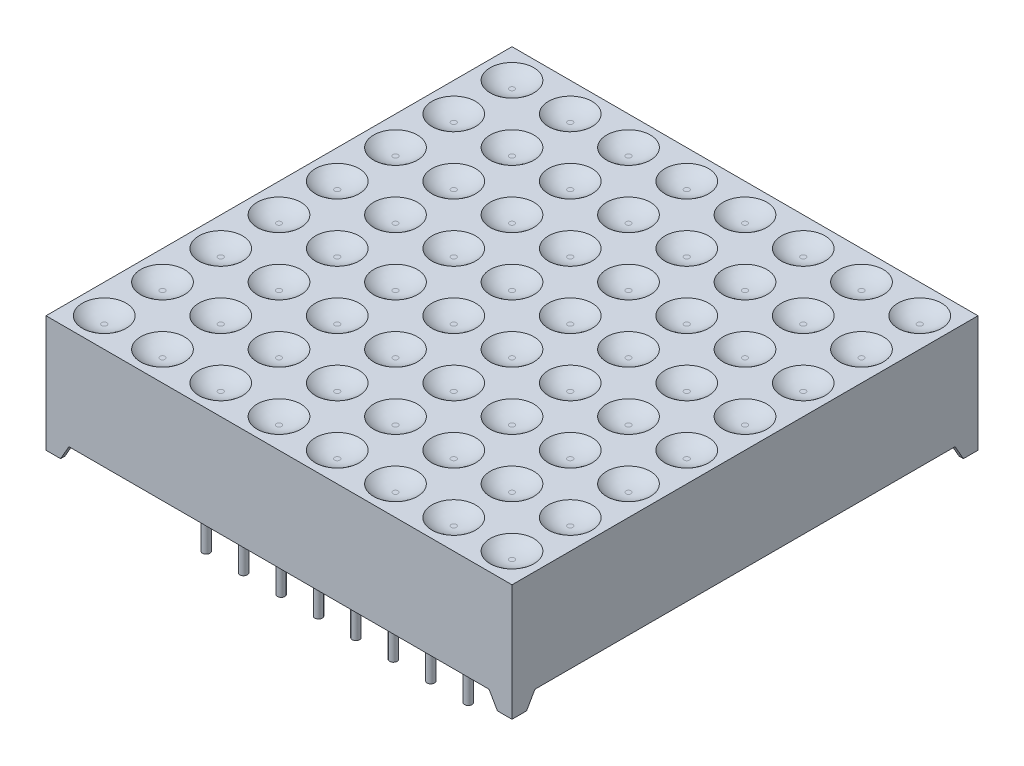
from build123d import *

# Parameters (mm, degrees)
SKETCH1_W           = 32
SKETCH1_H           = 32
BOSS_EXTRUDE1_DEPTH = 4
SKETCH2_W           = 31.4
SKETCH2_H           = 31.4
CUT_EXTRUDE1_DEPTH  = 1.5
CUT_EXTRUDE2_DEPTH  = 37
CUT_EXTRUDE3_DEPTH  = 37
SKETCH5_R           = 1.5
CUT_EXTRUDE4_DEPTH  = 0.5
FILLET1_R           = 2
SKETCH6_R           = 0.255
BOSS_EXTRUDE2_DEPTH = 6


with BuildPart() as part:
    # Sketch1 → Boss-Extrude1 (new, symmetric)
    with BuildSketch(Plane(origin=(0, 0, 0), x_dir=(1, 0, 0), z_dir=(0, 1, 0))):
        Rectangle(SKETCH1_W, SKETCH1_H)
    extrude(amount=BOSS_EXTRUDE1_DEPTH, both=True)

    # Sketch2 → Cut-Extrude1 (cut)
    with BuildSketch(Plane.XZ.offset(4)):
        Rectangle(SKETCH2_W, SKETCH2_H)
    extrude(amount=-CUT_EXTRUDE1_DEPTH, mode=Mode.SUBTRACT)

    # Sketch3 → Cut-Extrude2 (cut, through all)
    with BuildSketch(Plane.XY.offset(16)):
        Polygon((-15, -4), (-14.422649731, -3), (14.422649731, -3), (15, -4), align=None)
    extrude(amount=-CUT_EXTRUDE2_DEPTH, mode=Mode.SUBTRACT)

    # Sketch4 → Cut-Extrude3 (cut, through all)
    with BuildSketch(Plane.ZY.offset(16)):
        Polygon((-15, -4), (-14.422649731, -3), (14.422649731, -3), (15, -4), align=None)
    extrude(amount=-CUT_EXTRUDE3_DEPTH, mode=Mode.SUBTRACT)

    # Sketch5 → Cut-Extrude4 (cut)
    with BuildSketch(Plane(origin=(0, 4, 0), x_dir=(1, 0, 0), z_dir=(0, 1, 0))):
        with Locations(Location((-14, 14, 0), (0, 0, 270))):
            Circle(SKETCH5_R)
        with Locations(Location((-10, 14, 0), (0, 0, 270))):
            Circle(SKETCH5_R)
        with Locations(Location((-6, 14, 0), (0, 0, 270))):
            Circle(SKETCH5_R)
        with Locations(Location((-2, 14, 0), (0, 0, 270))):
            Circle(SKETCH5_R)
        with Locations(Location((2, 14, 0), (0, 0, 270))):
            Circle(SKETCH5_R)
        with Locations(Location((6, 14, 0), (0, 0, 270))):
            Circle(SKETCH5_R)
        with Locations(Location((10, 14, 0), (0, 0, 270))):
            Circle(SKETCH5_R)
        with Locations(Location((14, 14, 0), (0, 0, 270))):
            Circle(SKETCH5_R)
        with Locations(Location((-14, 10, 0), (0, 0, 270))):
            Circle(SKETCH5_R)
        with Locations(Location((-10, 10, 0), (0, 0, 270))):
            Circle(SKETCH5_R)
        with Locations(Location((-6, 10, 0), (0, 0, 270))):
            Circle(SKETCH5_R)
        with Locations(Location((-2, 10, 0), (0, 0, 270))):
            Circle(SKETCH5_R)
        with Locations(Location((2, 10, 0), (0, 0, 270))):
            Circle(SKETCH5_R)
        with Locations(Location((6, 10, 0), (0, 0, 270))):
            Circle(SKETCH5_R)
        with Locations(Location((10, 10, 0), (0, 0, 270))):
            Circle(SKETCH5_R)
        with Locations(Location((14, 10, 0), (0, 0, 270))):
            Circle(SKETCH5_R)
        with Locations(Location((-14, 6, 0), (0, 0, 270))):
            Circle(SKETCH5_R)
        with Locations(Location((-10, 6, 0), (0, 0, 270))):
            Circle(SKETCH5_R)
        with Locations(Location((-6, 6, 0), (0, 0, 270))):
            Circle(SKETCH5_R)
        with Locations(Location((-2, 6, 0), (0, 0, 270))):
            Circle(SKETCH5_R)
        with Locations(Location((2, 6, 0), (0, 0, 270))):
            Circle(SKETCH5_R)
        with Locations(Location((6, 6, 0), (0, 0, 270))):
            Circle(SKETCH5_R)
        with Locations(Location((10, 6, 0), (0, 0, 270))):
            Circle(SKETCH5_R)
        with Locations(Location((14, 6, 0), (0, 0, 270))):
            Circle(SKETCH5_R)
        with Locations(Location((-14, 2, 0), (0, 0, 270))):
            Circle(SKETCH5_R)
        with Locations(Location((-10, 2, 0), (0, 0, 270))):
            Circle(SKETCH5_R)
        with Locations(Location((-6, 2, 0), (0, 0, 270))):
            Circle(SKETCH5_R)
        with Locations(Location((-2, 2, 0), (0, 0, 270))):
            Circle(SKETCH5_R)
        with Locations(Location((2, 2, 0), (0, 0, 270))):
            Circle(SKETCH5_R)
        with Locations(Location((6, 2, 0), (0, 0, 270))):
            Circle(SKETCH5_R)
        with Locations(Location((10, 2, 0), (0, 0, 270))):
            Circle(SKETCH5_R)
        with Locations(Location((14, 2, 0), (0, 0, 270))):
            Circle(SKETCH5_R)
        with Locations(Location((-14, -2, 0), (0, 0, 270))):
            Circle(SKETCH5_R)
        with Locations(Location((-10, -2, 0), (0, 0, 270))):
            Circle(SKETCH5_R)
        with Locations(Location((-6, -2, 0), (0, 0, 270))):
            Circle(SKETCH5_R)
        with Locations(Location((-2, -2, 0), (0, 0, 270))):
            Circle(SKETCH5_R)
        with Locations(Location((2, -2, 0), (0, 0, 270))):
            Circle(SKETCH5_R)
        with Locations(Location((6, -2, 0), (0, 0, 270))):
            Circle(SKETCH5_R)
        with Locations(Location((10, -2, 0), (0, 0, 270))):
            Circle(SKETCH5_R)
        with Locations(Location((14, -2, 0), (0, 0, 270))):
            Circle(SKETCH5_R)
        with Locations(Location((-14, -6, 0), (0, 0, 270))):
            Circle(SKETCH5_R)
        with Locations(Location((-10, -6, 0), (0, 0, 270))):
            Circle(SKETCH5_R)
        with Locations(Location((-6, -6, 0), (0, 0, 270))):
            Circle(SKETCH5_R)
        with Locations(Location((-2, -6, 0), (0, 0, 270))):
            Circle(SKETCH5_R)
        with Locations(Location((2, -6, 0), (0, 0, 270))):
            Circle(SKETCH5_R)
        with Locations(Location((6, -6, 0), (0, 0, 270))):
            Circle(SKETCH5_R)
        with Locations(Location((10, -6, 0), (0, 0, 270))):
            Circle(SKETCH5_R)
        with Locations(Location((14, -6, 0), (0, 0, 270))):
            Circle(SKETCH5_R)
        with Locations(Location((-14, -10, 0), (0, 0, 270))):
            Circle(SKETCH5_R)
        with Locations(Location((-10, -10, 0), (0, 0, 270))):
            Circle(SKETCH5_R)
        with Locations(Location((-6, -10, 0), (0, 0, 270))):
            Circle(SKETCH5_R)
        with Locations(Location((-2, -10, 0), (0, 0, 270))):
            Circle(SKETCH5_R)
        with Locations(Location((2, -10, 0), (0, 0, 270))):
            Circle(SKETCH5_R)
        with Locations(Location((6, -10, 0), (0, 0, 270))):
            Circle(SKETCH5_R)
        with Locations(Location((10, -10, 0), (0, 0, 270))):
            Circle(SKETCH5_R)
        with Locations(Location((14, -10, 0), (0, 0, 270))):
            Circle(SKETCH5_R)
        with Locations(Location((-14, -14, 0), (0, 0, 270))):
            Circle(SKETCH5_R)
        with Locations(Location((-10, -14, 0), (0, 0, 270))):
            Circle(SKETCH5_R)
        with Locations(Location((-6, -14, 0), (0, 0, 270))):
            Circle(SKETCH5_R)
        with Locations(Location((-2, -14, 0), (0, 0, 270))):
            Circle(SKETCH5_R)
        with Locations(Location((2, -14, 0), (0, 0, 270))):
            Circle(SKETCH5_R)
        with Locations(Location((6, -14, 0), (0, 0, 270))):
            Circle(SKETCH5_R)
        with Locations(Location((10, -14, 0), (0, 0, 270))):
            Circle(SKETCH5_R)
        with Locations(Location((14, -14, 0), (0, 0, 270))):
            Circle(SKETCH5_R)
    extrude(amount=-CUT_EXTRUDE4_DEPTH, mode=Mode.SUBTRACT)

    # Fillet1
    # the kernel refuses this fillet: 2 mm, written as the material it adds along each edge
    with BuildSketch(Plane(origin=(6, 3.5, -14), x_dir=(0, 0, 1), z_dir=(-1, 0, 0))) as fillet1_piece_1:
        with BuildLine():
            CenterArc((0.177124344, 2), FILLET1_R, 270, 41.409622109)
            Line((0.177124344, 0), (0.177124344, -0.04))
            Line((0.177124344, -0.04), (1.5, -0.04))
            Line((1.5, -0.04), (1.54, 0))
            ThreePointArc((1.54, 0), (1.54, 0.25), (1.526457513, 0.47))
            Line((1.526457513, 0.47), (1.5, 0.5))
        make_face()
    fillet1_piece_1_solid = revolve(axis=Axis((6, 3.5, -14), (0, 1, 0)), mode=Mode.PRIVATE)
    with BuildSketch(Plane(origin=(10, 3.5, -14), x_dir=(0, 0, 1), z_dir=(-1, 0, 0))) as fillet1_piece_2:
        with BuildLine():
            CenterArc((0.177124344, 2), FILLET1_R, 270, 41.409622109)
            Line((0.177124344, 0), (0.177124344, -0.04))
            Line((0.177124344, -0.04), (1.5, -0.04))
            Line((1.5, -0.04), (1.54, 0))
            ThreePointArc((1.54, 0), (1.54, 0.25), (1.526457513, 0.47))
            Line((1.526457513, 0.47), (1.5, 0.5))
        make_face()
    fillet1_piece_2_solid = revolve(axis=Axis((10, 3.5, -14), (0, 1, 0)), mode=Mode.PRIVATE)
    with BuildSketch(Plane(origin=(14, 3.5, -14), x_dir=(0, 0, 1), z_dir=(-1, 0, 0))) as fillet1_piece_3:
        with BuildLine():
            CenterArc((0.177124344, 2), FILLET1_R, 270, 41.409622109)
            Line((0.177124344, 0), (0.177124344, -0.04))
            Line((0.177124344, -0.04), (1.5, -0.04))
            Line((1.5, -0.04), (1.54, 0))
            ThreePointArc((1.54, 0), (1.54, 0.25), (1.526457513, 0.47))
            Line((1.526457513, 0.47), (1.5, 0.5))
        make_face()
    fillet1_piece_3_solid = revolve(axis=Axis((14, 3.5, -14), (0, 1, 0)), mode=Mode.PRIVATE)
    with BuildSketch(Plane(origin=(-14, 3.5, -10), x_dir=(0, 0, 1), z_dir=(-1, 0, 0))) as fillet1_piece_4:
        with BuildLine():
            CenterArc((0.177124344, 2), FILLET1_R, 270, 41.409622109)
            Line((0.177124344, 0), (0.177124344, -0.04))
            Line((0.177124344, -0.04), (1.5, -0.04))
            Line((1.5, -0.04), (1.54, 0))
            ThreePointArc((1.54, 0), (1.54, 0.25), (1.526457513, 0.47))
            Line((1.526457513, 0.47), (1.5, 0.5))
        make_face()
    fillet1_piece_4_solid = revolve(axis=Axis((-14, 3.5, -10), (0, 1, 0)), mode=Mode.PRIVATE)
    with BuildSketch(Plane(origin=(-10, 3.5, -10), x_dir=(0, 0, 1), z_dir=(-1, 0, 0))) as fillet1_piece_5:
        with BuildLine():
            CenterArc((0.177124344, 2), FILLET1_R, 270, 41.409622109)
            Line((0.177124344, 0), (0.177124344, -0.04))
            Line((0.177124344, -0.04), (1.5, -0.04))
            Line((1.5, -0.04), (1.54, 0))
            ThreePointArc((1.54, 0), (1.54, 0.25), (1.526457513, 0.47))
            Line((1.526457513, 0.47), (1.5, 0.5))
        make_face()
    fillet1_piece_5_solid = revolve(axis=Axis((-10, 3.5, -10), (0, 1, 0)), mode=Mode.PRIVATE)
    with BuildSketch(Plane(origin=(-6, 3.5, -10), x_dir=(0, 0, 1), z_dir=(-1, 0, 0))) as fillet1_piece_6:
        with BuildLine():
            CenterArc((0.177124344, 2), FILLET1_R, 270, 41.409622109)
            Line((0.177124344, 0), (0.177124344, -0.04))
            Line((0.177124344, -0.04), (1.5, -0.04))
            Line((1.5, -0.04), (1.54, 0))
            ThreePointArc((1.54, 0), (1.54, 0.25), (1.526457513, 0.47))
            Line((1.526457513, 0.47), (1.5, 0.5))
        make_face()
    fillet1_piece_6_solid = revolve(axis=Axis((-6, 3.5, -10), (0, 1, 0)), mode=Mode.PRIVATE)
    with BuildSketch(Plane(origin=(-2, 3.5, -10), x_dir=(0, 0, 1), z_dir=(-1, 0, 0))) as fillet1_piece_7:
        with BuildLine():
            CenterArc((0.177124344, 2), FILLET1_R, 270, 41.409622109)
            Line((0.177124344, 0), (0.177124344, -0.04))
            Line((0.177124344, -0.04), (1.5, -0.04))
            Line((1.5, -0.04), (1.54, 0))
            ThreePointArc((1.54, 0), (1.54, 0.25), (1.526457513, 0.47))
            Line((1.526457513, 0.47), (1.5, 0.5))
        make_face()
    fillet1_piece_7_solid = revolve(axis=Axis((-2, 3.5, -10), (0, 1, 0)), mode=Mode.PRIVATE)
    with BuildSketch(Plane(origin=(2, 3.5, -10), x_dir=(0, 0, 1), z_dir=(-1, 0, 0))) as fillet1_piece_8:
        with BuildLine():
            CenterArc((0.177124344, 2), FILLET1_R, 270, 41.409622109)
            Line((0.177124344, 0), (0.177124344, -0.04))
            Line((0.177124344, -0.04), (1.5, -0.04))
            Line((1.5, -0.04), (1.54, 0))
            ThreePointArc((1.54, 0), (1.54, 0.25), (1.526457513, 0.47))
            Line((1.526457513, 0.47), (1.5, 0.5))
        make_face()
    fillet1_piece_8_solid = revolve(axis=Axis((2, 3.5, -10), (0, 1, 0)), mode=Mode.PRIVATE)
    with BuildSketch(Plane(origin=(6, 3.5, -10), x_dir=(0, 0, 1), z_dir=(-1, 0, 0))) as fillet1_piece_9:
        with BuildLine():
            CenterArc((0.177124344, 2), FILLET1_R, 270, 41.409622109)
            Line((0.177124344, 0), (0.177124344, -0.04))
            Line((0.177124344, -0.04), (1.5, -0.04))
            Line((1.5, -0.04), (1.54, 0))
            ThreePointArc((1.54, 0), (1.54, 0.25), (1.526457513, 0.47))
            Line((1.526457513, 0.47), (1.5, 0.5))
        make_face()
    fillet1_piece_9_solid = revolve(axis=Axis((6, 3.5, -10), (0, 1, 0)), mode=Mode.PRIVATE)
    with BuildSketch(Plane(origin=(10, 3.5, -10), x_dir=(0, 0, 1), z_dir=(-1, 0, 0))) as fillet1_piece_10:
        with BuildLine():
            CenterArc((0.177124344, 2), FILLET1_R, 270, 41.409622109)
            Line((0.177124344, 0), (0.177124344, -0.04))
            Line((0.177124344, -0.04), (1.5, -0.04))
            Line((1.5, -0.04), (1.54, 0))
            ThreePointArc((1.54, 0), (1.54, 0.25), (1.526457513, 0.47))
            Line((1.526457513, 0.47), (1.5, 0.5))
        make_face()
    fillet1_piece_10_solid = revolve(axis=Axis((10, 3.5, -10), (0, 1, 0)), mode=Mode.PRIVATE)
    with BuildSketch(Plane(origin=(14, 3.5, -10), x_dir=(0, 0, 1), z_dir=(-1, 0, 0))) as fillet1_piece_11:
        with BuildLine():
            CenterArc((0.177124344, 2), FILLET1_R, 270, 41.409622109)
            Line((0.177124344, 0), (0.177124344, -0.04))
            Line((0.177124344, -0.04), (1.5, -0.04))
            Line((1.5, -0.04), (1.54, 0))
            ThreePointArc((1.54, 0), (1.54, 0.25), (1.526457513, 0.47))
            Line((1.526457513, 0.47), (1.5, 0.5))
        make_face()
    fillet1_piece_11_solid = revolve(axis=Axis((14, 3.5, -10), (0, 1, 0)), mode=Mode.PRIVATE)
    with BuildSketch(Plane(origin=(-14, 3.5, -6), x_dir=(0, 0, 1), z_dir=(-1, 0, 0))) as fillet1_piece_12:
        with BuildLine():
            CenterArc((0.177124344, 2), FILLET1_R, 270, 41.409622109)
            Line((0.177124344, 0), (0.177124344, -0.04))
            Line((0.177124344, -0.04), (1.5, -0.04))
            Line((1.5, -0.04), (1.54, 0))
            ThreePointArc((1.54, 0), (1.54, 0.25), (1.526457513, 0.47))
            Line((1.526457513, 0.47), (1.5, 0.5))
        make_face()
    fillet1_piece_12_solid = revolve(axis=Axis((-14, 3.5, -6), (0, 1, 0)), mode=Mode.PRIVATE)
    with BuildSketch(Plane(origin=(-10, 3.5, -6), x_dir=(0, 0, 1), z_dir=(-1, 0, 0))) as fillet1_piece_13:
        with BuildLine():
            CenterArc((0.177124344, 2), FILLET1_R, 270, 41.409622109)
            Line((0.177124344, 0), (0.177124344, -0.04))
            Line((0.177124344, -0.04), (1.5, -0.04))
            Line((1.5, -0.04), (1.54, 0))
            ThreePointArc((1.54, 0), (1.54, 0.25), (1.526457513, 0.47))
            Line((1.526457513, 0.47), (1.5, 0.5))
        make_face()
    fillet1_piece_13_solid = revolve(axis=Axis((-10, 3.5, -6), (0, 1, 0)), mode=Mode.PRIVATE)
    with BuildSketch(Plane(origin=(-6, 3.5, -6), x_dir=(0, 0, 1), z_dir=(-1, 0, 0))) as fillet1_piece_14:
        with BuildLine():
            CenterArc((0.177124344, 2), FILLET1_R, 270, 41.409622109)
            Line((0.177124344, 0), (0.177124344, -0.04))
            Line((0.177124344, -0.04), (1.5, -0.04))
            Line((1.5, -0.04), (1.54, 0))
            ThreePointArc((1.54, 0), (1.54, 0.25), (1.526457513, 0.47))
            Line((1.526457513, 0.47), (1.5, 0.5))
        make_face()
    fillet1_piece_14_solid = revolve(axis=Axis((-6, 3.5, -6), (0, 1, 0)), mode=Mode.PRIVATE)
    with BuildSketch(Plane(origin=(-2, 3.5, -6), x_dir=(0, 0, 1), z_dir=(-1, 0, 0))) as fillet1_piece_15:
        with BuildLine():
            CenterArc((0.177124344, 2), FILLET1_R, 270, 41.409622109)
            Line((0.177124344, 0), (0.177124344, -0.04))
            Line((0.177124344, -0.04), (1.5, -0.04))
            Line((1.5, -0.04), (1.54, 0))
            ThreePointArc((1.54, 0), (1.54, 0.25), (1.526457513, 0.47))
            Line((1.526457513, 0.47), (1.5, 0.5))
        make_face()
    fillet1_piece_15_solid = revolve(axis=Axis((-2, 3.5, -6), (0, 1, 0)), mode=Mode.PRIVATE)
    with BuildSketch(Plane(origin=(2, 3.5, -6), x_dir=(0, 0, 1), z_dir=(-1, 0, 0))) as fillet1_piece_16:
        with BuildLine():
            CenterArc((0.177124344, 2), FILLET1_R, 270, 41.409622109)
            Line((0.177124344, 0), (0.177124344, -0.04))
            Line((0.177124344, -0.04), (1.5, -0.04))
            Line((1.5, -0.04), (1.54, 0))
            ThreePointArc((1.54, 0), (1.54, 0.25), (1.526457513, 0.47))
            Line((1.526457513, 0.47), (1.5, 0.5))
        make_face()
    fillet1_piece_16_solid = revolve(axis=Axis((2, 3.5, -6), (0, 1, 0)), mode=Mode.PRIVATE)
    with BuildSketch(Plane(origin=(6, 3.5, -6), x_dir=(0, 0, 1), z_dir=(-1, 0, 0))) as fillet1_piece_17:
        with BuildLine():
            CenterArc((0.177124344, 2), FILLET1_R, 270, 41.409622109)
            Line((0.177124344, 0), (0.177124344, -0.04))
            Line((0.177124344, -0.04), (1.5, -0.04))
            Line((1.5, -0.04), (1.54, 0))
            ThreePointArc((1.54, 0), (1.54, 0.25), (1.526457513, 0.47))
            Line((1.526457513, 0.47), (1.5, 0.5))
        make_face()
    fillet1_piece_17_solid = revolve(axis=Axis((6, 3.5, -6), (0, 1, 0)), mode=Mode.PRIVATE)
    with BuildSketch(Plane(origin=(10, 3.5, -6), x_dir=(0, 0, 1), z_dir=(-1, 0, 0))) as fillet1_piece_18:
        with BuildLine():
            CenterArc((0.177124344, 2), FILLET1_R, 270, 41.409622109)
            Line((0.177124344, 0), (0.177124344, -0.04))
            Line((0.177124344, -0.04), (1.5, -0.04))
            Line((1.5, -0.04), (1.54, 0))
            ThreePointArc((1.54, 0), (1.54, 0.25), (1.526457513, 0.47))
            Line((1.526457513, 0.47), (1.5, 0.5))
        make_face()
    fillet1_piece_18_solid = revolve(axis=Axis((10, 3.5, -6), (0, 1, 0)), mode=Mode.PRIVATE)
    with BuildSketch(Plane(origin=(14, 3.5, -6), x_dir=(0, 0, 1), z_dir=(-1, 0, 0))) as fillet1_piece_19:
        with BuildLine():
            CenterArc((0.177124344, 2), FILLET1_R, 270, 41.409622109)
            Line((0.177124344, 0), (0.177124344, -0.04))
            Line((0.177124344, -0.04), (1.5, -0.04))
            Line((1.5, -0.04), (1.54, 0))
            ThreePointArc((1.54, 0), (1.54, 0.25), (1.526457513, 0.47))
            Line((1.526457513, 0.47), (1.5, 0.5))
        make_face()
    fillet1_piece_19_solid = revolve(axis=Axis((14, 3.5, -6), (0, 1, 0)), mode=Mode.PRIVATE)
    with BuildSketch(Plane(origin=(-14, 3.5, -2), x_dir=(0, 0, 1), z_dir=(-1, 0, 0))) as fillet1_piece_20:
        with BuildLine():
            CenterArc((0.177124344, 2), FILLET1_R, 270, 41.409622109)
            Line((0.177124344, 0), (0.177124344, -0.04))
            Line((0.177124344, -0.04), (1.5, -0.04))
            Line((1.5, -0.04), (1.54, 0))
            ThreePointArc((1.54, 0), (1.54, 0.25), (1.526457513, 0.47))
            Line((1.526457513, 0.47), (1.5, 0.5))
        make_face()
    fillet1_piece_20_solid = revolve(axis=Axis((-14, 3.5, -2), (0, 1, 0)), mode=Mode.PRIVATE)
    with BuildSketch(Plane(origin=(-10, 3.5, -2), x_dir=(0, 0, 1), z_dir=(-1, 0, 0))) as fillet1_piece_21:
        with BuildLine():
            CenterArc((0.177124344, 2), FILLET1_R, 270, 41.409622109)
            Line((0.177124344, 0), (0.177124344, -0.04))
            Line((0.177124344, -0.04), (1.5, -0.04))
            Line((1.5, -0.04), (1.54, 0))
            ThreePointArc((1.54, 0), (1.54, 0.25), (1.526457513, 0.47))
            Line((1.526457513, 0.47), (1.5, 0.5))
        make_face()
    fillet1_piece_21_solid = revolve(axis=Axis((-10, 3.5, -2), (0, 1, 0)), mode=Mode.PRIVATE)
    with BuildSketch(Plane(origin=(-6, 3.5, -2), x_dir=(0, 0, 1), z_dir=(-1, 0, 0))) as fillet1_piece_22:
        with BuildLine():
            CenterArc((0.177124344, 2), FILLET1_R, 270, 41.409622109)
            Line((0.177124344, 0), (0.177124344, -0.04))
            Line((0.177124344, -0.04), (1.5, -0.04))
            Line((1.5, -0.04), (1.54, 0))
            ThreePointArc((1.54, 0), (1.54, 0.25), (1.526457513, 0.47))
            Line((1.526457513, 0.47), (1.5, 0.5))
        make_face()
    fillet1_piece_22_solid = revolve(axis=Axis((-6, 3.5, -2), (0, 1, 0)), mode=Mode.PRIVATE)
    with BuildSketch(Plane(origin=(-2, 3.5, -2), x_dir=(0, 0, 1), z_dir=(-1, 0, 0))) as fillet1_piece_23:
        with BuildLine():
            CenterArc((0.177124344, 2), FILLET1_R, 270, 41.409622109)
            Line((0.177124344, 0), (0.177124344, -0.04))
            Line((0.177124344, -0.04), (1.5, -0.04))
            Line((1.5, -0.04), (1.54, 0))
            ThreePointArc((1.54, 0), (1.54, 0.25), (1.526457513, 0.47))
            Line((1.526457513, 0.47), (1.5, 0.5))
        make_face()
    fillet1_piece_23_solid = revolve(axis=Axis((-2, 3.5, -2), (0, 1, 0)), mode=Mode.PRIVATE)
    with BuildSketch(Plane(origin=(2, 3.5, -2), x_dir=(0, 0, 1), z_dir=(-1, 0, 0))) as fillet1_piece_24:
        with BuildLine():
            CenterArc((0.177124344, 2), FILLET1_R, 270, 41.409622109)
            Line((0.177124344, 0), (0.177124344, -0.04))
            Line((0.177124344, -0.04), (1.5, -0.04))
            Line((1.5, -0.04), (1.54, 0))
            ThreePointArc((1.54, 0), (1.54, 0.25), (1.526457513, 0.47))
            Line((1.526457513, 0.47), (1.5, 0.5))
        make_face()
    fillet1_piece_24_solid = revolve(axis=Axis((2, 3.5, -2), (0, 1, 0)), mode=Mode.PRIVATE)
    with BuildSketch(Plane(origin=(6, 3.5, -2), x_dir=(0, 0, 1), z_dir=(-1, 0, 0))) as fillet1_piece_25:
        with BuildLine():
            CenterArc((0.177124344, 2), FILLET1_R, 270, 41.409622109)
            Line((0.177124344, 0), (0.177124344, -0.04))
            Line((0.177124344, -0.04), (1.5, -0.04))
            Line((1.5, -0.04), (1.54, 0))
            ThreePointArc((1.54, 0), (1.54, 0.25), (1.526457513, 0.47))
            Line((1.526457513, 0.47), (1.5, 0.5))
        make_face()
    fillet1_piece_25_solid = revolve(axis=Axis((6, 3.5, -2), (0, 1, 0)), mode=Mode.PRIVATE)
    with BuildSketch(Plane(origin=(10, 3.5, -2), x_dir=(0, 0, 1), z_dir=(-1, 0, 0))) as fillet1_piece_26:
        with BuildLine():
            CenterArc((0.177124344, 2), FILLET1_R, 270, 41.409622109)
            Line((0.177124344, 0), (0.177124344, -0.04))
            Line((0.177124344, -0.04), (1.5, -0.04))
            Line((1.5, -0.04), (1.54, 0))
            ThreePointArc((1.54, 0), (1.54, 0.25), (1.526457513, 0.47))
            Line((1.526457513, 0.47), (1.5, 0.5))
        make_face()
    fillet1_piece_26_solid = revolve(axis=Axis((10, 3.5, -2), (0, 1, 0)), mode=Mode.PRIVATE)
    with BuildSketch(Plane(origin=(14, 3.5, -2), x_dir=(0, 0, 1), z_dir=(-1, 0, 0))) as fillet1_piece_27:
        with BuildLine():
            CenterArc((0.177124344, 2), FILLET1_R, 270, 41.409622109)
            Line((0.177124344, 0), (0.177124344, -0.04))
            Line((0.177124344, -0.04), (1.5, -0.04))
            Line((1.5, -0.04), (1.54, 0))
            ThreePointArc((1.54, 0), (1.54, 0.25), (1.526457513, 0.47))
            Line((1.526457513, 0.47), (1.5, 0.5))
        make_face()
    fillet1_piece_27_solid = revolve(axis=Axis((14, 3.5, -2), (0, 1, 0)), mode=Mode.PRIVATE)
    with BuildSketch(Plane(origin=(-14, 3.5, 2), x_dir=(0, 0, 1), z_dir=(-1, 0, 0))) as fillet1_piece_28:
        with BuildLine():
            CenterArc((0.177124344, 2), FILLET1_R, 270, 41.409622109)
            Line((0.177124344, 0), (0.177124344, -0.04))
            Line((0.177124344, -0.04), (1.5, -0.04))
            Line((1.5, -0.04), (1.54, 0))
            ThreePointArc((1.54, 0), (1.54, 0.25), (1.526457513, 0.47))
            Line((1.526457513, 0.47), (1.5, 0.5))
        make_face()
    fillet1_piece_28_solid = revolve(axis=Axis((-14, 3.5, 2), (0, 1, 0)), mode=Mode.PRIVATE)
    with BuildSketch(Plane(origin=(-10, 3.5, 2), x_dir=(0, 0, 1), z_dir=(-1, 0, 0))) as fillet1_piece_29:
        with BuildLine():
            CenterArc((0.177124344, 2), FILLET1_R, 270, 41.409622109)
            Line((0.177124344, 0), (0.177124344, -0.04))
            Line((0.177124344, -0.04), (1.5, -0.04))
            Line((1.5, -0.04), (1.54, 0))
            ThreePointArc((1.54, 0), (1.54, 0.25), (1.526457513, 0.47))
            Line((1.526457513, 0.47), (1.5, 0.5))
        make_face()
    fillet1_piece_29_solid = revolve(axis=Axis((-10, 3.5, 2), (0, 1, 0)), mode=Mode.PRIVATE)
    with BuildSketch(Plane(origin=(-6, 3.5, 2), x_dir=(0, 0, 1), z_dir=(-1, 0, 0))) as fillet1_piece_30:
        with BuildLine():
            CenterArc((0.177124344, 2), FILLET1_R, 270, 41.409622109)
            Line((0.177124344, 0), (0.177124344, -0.04))
            Line((0.177124344, -0.04), (1.5, -0.04))
            Line((1.5, -0.04), (1.54, 0))
            ThreePointArc((1.54, 0), (1.54, 0.25), (1.526457513, 0.47))
            Line((1.526457513, 0.47), (1.5, 0.5))
        make_face()
    fillet1_piece_30_solid = revolve(axis=Axis((-6, 3.5, 2), (0, 1, 0)), mode=Mode.PRIVATE)
    with BuildSketch(Plane(origin=(-2, 3.5, 2), x_dir=(0, 0, 1), z_dir=(-1, 0, 0))) as fillet1_piece_31:
        with BuildLine():
            CenterArc((0.177124344, 2), FILLET1_R, 270, 41.409622109)
            Line((0.177124344, 0), (0.177124344, -0.04))
            Line((0.177124344, -0.04), (1.5, -0.04))
            Line((1.5, -0.04), (1.54, 0))
            ThreePointArc((1.54, 0), (1.54, 0.25), (1.526457513, 0.47))
            Line((1.526457513, 0.47), (1.5, 0.5))
        make_face()
    fillet1_piece_31_solid = revolve(axis=Axis((-2, 3.5, 2), (0, 1, 0)), mode=Mode.PRIVATE)
    with BuildSketch(Plane(origin=(2, 3.5, 2), x_dir=(0, 0, 1), z_dir=(-1, 0, 0))) as fillet1_piece_32:
        with BuildLine():
            CenterArc((0.177124344, 2), FILLET1_R, 270, 41.409622109)
            Line((0.177124344, 0), (0.177124344, -0.04))
            Line((0.177124344, -0.04), (1.5, -0.04))
            Line((1.5, -0.04), (1.54, 0))
            ThreePointArc((1.54, 0), (1.54, 0.25), (1.526457513, 0.47))
            Line((1.526457513, 0.47), (1.5, 0.5))
        make_face()
    fillet1_piece_32_solid = revolve(axis=Axis((2, 3.5, 2), (0, 1, 0)), mode=Mode.PRIVATE)
    with BuildSketch(Plane(origin=(6, 3.5, 2), x_dir=(0, 0, 1), z_dir=(-1, 0, 0))) as fillet1_piece_33:
        with BuildLine():
            CenterArc((0.177124344, 2), FILLET1_R, 270, 41.409622109)
            Line((0.177124344, 0), (0.177124344, -0.04))
            Line((0.177124344, -0.04), (1.5, -0.04))
            Line((1.5, -0.04), (1.54, 0))
            ThreePointArc((1.54, 0), (1.54, 0.25), (1.526457513, 0.47))
            Line((1.526457513, 0.47), (1.5, 0.5))
        make_face()
    fillet1_piece_33_solid = revolve(axis=Axis((6, 3.5, 2), (0, 1, 0)), mode=Mode.PRIVATE)
    with BuildSketch(Plane(origin=(10, 3.5, 2), x_dir=(0, 0, 1), z_dir=(-1, 0, 0))) as fillet1_piece_34:
        with BuildLine():
            CenterArc((0.177124344, 2), FILLET1_R, 270, 41.409622109)
            Line((0.177124344, 0), (0.177124344, -0.04))
            Line((0.177124344, -0.04), (1.5, -0.04))
            Line((1.5, -0.04), (1.54, 0))
            ThreePointArc((1.54, 0), (1.54, 0.25), (1.526457513, 0.47))
            Line((1.526457513, 0.47), (1.5, 0.5))
        make_face()
    fillet1_piece_34_solid = revolve(axis=Axis((10, 3.5, 2), (0, 1, 0)), mode=Mode.PRIVATE)
    with BuildSketch(Plane(origin=(14, 3.5, 2), x_dir=(0, 0, 1), z_dir=(-1, 0, 0))) as fillet1_piece_35:
        with BuildLine():
            CenterArc((0.177124344, 2), FILLET1_R, 270, 41.409622109)
            Line((0.177124344, 0), (0.177124344, -0.04))
            Line((0.177124344, -0.04), (1.5, -0.04))
            Line((1.5, -0.04), (1.54, 0))
            ThreePointArc((1.54, 0), (1.54, 0.25), (1.526457513, 0.47))
            Line((1.526457513, 0.47), (1.5, 0.5))
        make_face()
    fillet1_piece_35_solid = revolve(axis=Axis((14, 3.5, 2), (0, 1, 0)), mode=Mode.PRIVATE)
    with BuildSketch(Plane(origin=(-14, 3.5, 6), x_dir=(0, 0, 1), z_dir=(-1, 0, 0))) as fillet1_piece_36:
        with BuildLine():
            CenterArc((0.177124344, 2), FILLET1_R, 270, 41.409622109)
            Line((0.177124344, 0), (0.177124344, -0.04))
            Line((0.177124344, -0.04), (1.5, -0.04))
            Line((1.5, -0.04), (1.54, 0))
            ThreePointArc((1.54, 0), (1.54, 0.25), (1.526457513, 0.47))
            Line((1.526457513, 0.47), (1.5, 0.5))
        make_face()
    fillet1_piece_36_solid = revolve(axis=Axis((-14, 3.5, 6), (0, 1, 0)), mode=Mode.PRIVATE)
    with BuildSketch(Plane(origin=(-10, 3.5, 6), x_dir=(0, 0, 1), z_dir=(-1, 0, 0))) as fillet1_piece_37:
        with BuildLine():
            CenterArc((0.177124344, 2), FILLET1_R, 270, 41.409622109)
            Line((0.177124344, 0), (0.177124344, -0.04))
            Line((0.177124344, -0.04), (1.5, -0.04))
            Line((1.5, -0.04), (1.54, 0))
            ThreePointArc((1.54, 0), (1.54, 0.25), (1.526457513, 0.47))
            Line((1.526457513, 0.47), (1.5, 0.5))
        make_face()
    fillet1_piece_37_solid = revolve(axis=Axis((-10, 3.5, 6), (0, 1, 0)), mode=Mode.PRIVATE)
    with BuildSketch(Plane(origin=(-6, 3.5, 6), x_dir=(0, 0, 1), z_dir=(-1, 0, 0))) as fillet1_piece_38:
        with BuildLine():
            CenterArc((0.177124344, 2), FILLET1_R, 270, 41.409622109)
            Line((0.177124344, 0), (0.177124344, -0.04))
            Line((0.177124344, -0.04), (1.5, -0.04))
            Line((1.5, -0.04), (1.54, 0))
            ThreePointArc((1.54, 0), (1.54, 0.25), (1.526457513, 0.47))
            Line((1.526457513, 0.47), (1.5, 0.5))
        make_face()
    fillet1_piece_38_solid = revolve(axis=Axis((-6, 3.5, 6), (0, 1, 0)), mode=Mode.PRIVATE)
    with BuildSketch(Plane(origin=(-2, 3.5, 6), x_dir=(0, 0, 1), z_dir=(-1, 0, 0))) as fillet1_piece_39:
        with BuildLine():
            CenterArc((0.177124344, 2), FILLET1_R, 270, 41.409622109)
            Line((0.177124344, 0), (0.177124344, -0.04))
            Line((0.177124344, -0.04), (1.5, -0.04))
            Line((1.5, -0.04), (1.54, 0))
            ThreePointArc((1.54, 0), (1.54, 0.25), (1.526457513, 0.47))
            Line((1.526457513, 0.47), (1.5, 0.5))
        make_face()
    fillet1_piece_39_solid = revolve(axis=Axis((-2, 3.5, 6), (0, 1, 0)), mode=Mode.PRIVATE)
    with BuildSketch(Plane(origin=(2, 3.5, 6), x_dir=(0, 0, 1), z_dir=(-1, 0, 0))) as fillet1_piece_40:
        with BuildLine():
            CenterArc((0.177124344, 2), FILLET1_R, 270, 41.409622109)
            Line((0.177124344, 0), (0.177124344, -0.04))
            Line((0.177124344, -0.04), (1.5, -0.04))
            Line((1.5, -0.04), (1.54, 0))
            ThreePointArc((1.54, 0), (1.54, 0.25), (1.526457513, 0.47))
            Line((1.526457513, 0.47), (1.5, 0.5))
        make_face()
    fillet1_piece_40_solid = revolve(axis=Axis((2, 3.5, 6), (0, 1, 0)), mode=Mode.PRIVATE)
    with BuildSketch(Plane(origin=(6, 3.5, 6), x_dir=(0, 0, 1), z_dir=(-1, 0, 0))) as fillet1_piece_41:
        with BuildLine():
            CenterArc((0.177124344, 2), FILLET1_R, 270, 41.409622109)
            Line((0.177124344, 0), (0.177124344, -0.04))
            Line((0.177124344, -0.04), (1.5, -0.04))
            Line((1.5, -0.04), (1.54, 0))
            ThreePointArc((1.54, 0), (1.54, 0.25), (1.526457513, 0.47))
            Line((1.526457513, 0.47), (1.5, 0.5))
        make_face()
    fillet1_piece_41_solid = revolve(axis=Axis((6, 3.5, 6), (0, 1, 0)), mode=Mode.PRIVATE)
    with BuildSketch(Plane(origin=(10, 3.5, 6), x_dir=(0, 0, 1), z_dir=(-1, 0, 0))) as fillet1_piece_42:
        with BuildLine():
            CenterArc((0.177124344, 2), FILLET1_R, 270, 41.409622109)
            Line((0.177124344, 0), (0.177124344, -0.04))
            Line((0.177124344, -0.04), (1.5, -0.04))
            Line((1.5, -0.04), (1.54, 0))
            ThreePointArc((1.54, 0), (1.54, 0.25), (1.526457513, 0.47))
            Line((1.526457513, 0.47), (1.5, 0.5))
        make_face()
    fillet1_piece_42_solid = revolve(axis=Axis((10, 3.5, 6), (0, 1, 0)), mode=Mode.PRIVATE)
    with BuildSketch(Plane(origin=(14, 3.5, 6), x_dir=(0, 0, 1), z_dir=(-1, 0, 0))) as fillet1_piece_43:
        with BuildLine():
            CenterArc((0.177124344, 2), FILLET1_R, 270, 41.409622109)
            Line((0.177124344, 0), (0.177124344, -0.04))
            Line((0.177124344, -0.04), (1.5, -0.04))
            Line((1.5, -0.04), (1.54, 0))
            ThreePointArc((1.54, 0), (1.54, 0.25), (1.526457513, 0.47))
            Line((1.526457513, 0.47), (1.5, 0.5))
        make_face()
    fillet1_piece_43_solid = revolve(axis=Axis((14, 3.5, 6), (0, 1, 0)), mode=Mode.PRIVATE)
    with BuildSketch(Plane(origin=(-14, 3.5, 10), x_dir=(0, 0, 1), z_dir=(-1, 0, 0))) as fillet1_piece_44:
        with BuildLine():
            CenterArc((0.177124344, 2), FILLET1_R, 270, 41.409622109)
            Line((0.177124344, 0), (0.177124344, -0.04))
            Line((0.177124344, -0.04), (1.5, -0.04))
            Line((1.5, -0.04), (1.54, 0))
            ThreePointArc((1.54, 0), (1.54, 0.25), (1.526457513, 0.47))
            Line((1.526457513, 0.47), (1.5, 0.5))
        make_face()
    fillet1_piece_44_solid = revolve(axis=Axis((-14, 3.5, 10), (0, 1, 0)), mode=Mode.PRIVATE)
    with BuildSketch(Plane(origin=(-10, 3.5, 10), x_dir=(0, 0, 1), z_dir=(-1, 0, 0))) as fillet1_piece_45:
        with BuildLine():
            CenterArc((0.177124344, 2), FILLET1_R, 270, 41.409622109)
            Line((0.177124344, 0), (0.177124344, -0.04))
            Line((0.177124344, -0.04), (1.5, -0.04))
            Line((1.5, -0.04), (1.54, 0))
            ThreePointArc((1.54, 0), (1.54, 0.25), (1.526457513, 0.47))
            Line((1.526457513, 0.47), (1.5, 0.5))
        make_face()
    fillet1_piece_45_solid = revolve(axis=Axis((-10, 3.5, 10), (0, 1, 0)), mode=Mode.PRIVATE)
    with BuildSketch(Plane(origin=(-6, 3.5, 10), x_dir=(0, 0, 1), z_dir=(-1, 0, 0))) as fillet1_piece_46:
        with BuildLine():
            CenterArc((0.177124344, 2), FILLET1_R, 270, 41.409622109)
            Line((0.177124344, 0), (0.177124344, -0.04))
            Line((0.177124344, -0.04), (1.5, -0.04))
            Line((1.5, -0.04), (1.54, 0))
            ThreePointArc((1.54, 0), (1.54, 0.25), (1.526457513, 0.47))
            Line((1.526457513, 0.47), (1.5, 0.5))
        make_face()
    fillet1_piece_46_solid = revolve(axis=Axis((-6, 3.5, 10), (0, 1, 0)), mode=Mode.PRIVATE)
    with BuildSketch(Plane(origin=(-2, 3.5, 10), x_dir=(0, 0, 1), z_dir=(-1, 0, 0))) as fillet1_piece_47:
        with BuildLine():
            CenterArc((0.177124344, 2), FILLET1_R, 270, 41.409622109)
            Line((0.177124344, 0), (0.177124344, -0.04))
            Line((0.177124344, -0.04), (1.5, -0.04))
            Line((1.5, -0.04), (1.54, 0))
            ThreePointArc((1.54, 0), (1.54, 0.25), (1.526457513, 0.47))
            Line((1.526457513, 0.47), (1.5, 0.5))
        make_face()
    fillet1_piece_47_solid = revolve(axis=Axis((-2, 3.5, 10), (0, 1, 0)), mode=Mode.PRIVATE)
    with BuildSketch(Plane(origin=(2, 3.5, 10), x_dir=(0, 0, 1), z_dir=(-1, 0, 0))) as fillet1_piece_48:
        with BuildLine():
            CenterArc((0.177124344, 2), FILLET1_R, 270, 41.409622109)
            Line((0.177124344, 0), (0.177124344, -0.04))
            Line((0.177124344, -0.04), (1.5, -0.04))
            Line((1.5, -0.04), (1.54, 0))
            ThreePointArc((1.54, 0), (1.54, 0.25), (1.526457513, 0.47))
            Line((1.526457513, 0.47), (1.5, 0.5))
        make_face()
    fillet1_piece_48_solid = revolve(axis=Axis((2, 3.5, 10), (0, 1, 0)), mode=Mode.PRIVATE)
    with BuildSketch(Plane(origin=(6, 3.5, 10), x_dir=(0, 0, 1), z_dir=(-1, 0, 0))) as fillet1_piece_49:
        with BuildLine():
            CenterArc((0.177124344, 2), FILLET1_R, 270, 41.409622109)
            Line((0.177124344, 0), (0.177124344, -0.04))
            Line((0.177124344, -0.04), (1.5, -0.04))
            Line((1.5, -0.04), (1.54, 0))
            ThreePointArc((1.54, 0), (1.54, 0.25), (1.526457513, 0.47))
            Line((1.526457513, 0.47), (1.5, 0.5))
        make_face()
    fillet1_piece_49_solid = revolve(axis=Axis((6, 3.5, 10), (0, 1, 0)), mode=Mode.PRIVATE)
    with BuildSketch(Plane(origin=(10, 3.5, 10), x_dir=(0, 0, 1), z_dir=(-1, 0, 0))) as fillet1_piece_50:
        with BuildLine():
            CenterArc((0.177124344, 2), FILLET1_R, 270, 41.409622109)
            Line((0.177124344, 0), (0.177124344, -0.04))
            Line((0.177124344, -0.04), (1.5, -0.04))
            Line((1.5, -0.04), (1.54, 0))
            ThreePointArc((1.54, 0), (1.54, 0.25), (1.526457513, 0.47))
            Line((1.526457513, 0.47), (1.5, 0.5))
        make_face()
    fillet1_piece_50_solid = revolve(axis=Axis((10, 3.5, 10), (0, 1, 0)), mode=Mode.PRIVATE)
    with BuildSketch(Plane(origin=(14, 3.5, 10), x_dir=(0, 0, 1), z_dir=(-1, 0, 0))) as fillet1_piece_51:
        with BuildLine():
            CenterArc((0.177124344, 2), FILLET1_R, 270, 41.409622109)
            Line((0.177124344, 0), (0.177124344, -0.04))
            Line((0.177124344, -0.04), (1.5, -0.04))
            Line((1.5, -0.04), (1.54, 0))
            ThreePointArc((1.54, 0), (1.54, 0.25), (1.526457513, 0.47))
            Line((1.526457513, 0.47), (1.5, 0.5))
        make_face()
    fillet1_piece_51_solid = revolve(axis=Axis((14, 3.5, 10), (0, 1, 0)), mode=Mode.PRIVATE)
    with BuildSketch(Plane(origin=(-14, 3.5, 14), x_dir=(0, 0, 1), z_dir=(-1, 0, 0))) as fillet1_piece_52:
        with BuildLine():
            CenterArc((0.177124344, 2), FILLET1_R, 270, 41.409622109)
            Line((0.177124344, 0), (0.177124344, -0.04))
            Line((0.177124344, -0.04), (1.5, -0.04))
            Line((1.5, -0.04), (1.54, 0))
            ThreePointArc((1.54, 0), (1.54, 0.25), (1.526457513, 0.47))
            Line((1.526457513, 0.47), (1.5, 0.5))
        make_face()
    fillet1_piece_52_solid = revolve(axis=Axis((-14, 3.5, 14), (0, 1, 0)), mode=Mode.PRIVATE)
    with BuildSketch(Plane(origin=(-10, 3.5, 14), x_dir=(0, 0, 1), z_dir=(-1, 0, 0))) as fillet1_piece_53:
        with BuildLine():
            CenterArc((0.177124344, 2), FILLET1_R, 270, 41.409622109)
            Line((0.177124344, 0), (0.177124344, -0.04))
            Line((0.177124344, -0.04), (1.5, -0.04))
            Line((1.5, -0.04), (1.54, 0))
            ThreePointArc((1.54, 0), (1.54, 0.25), (1.526457513, 0.47))
            Line((1.526457513, 0.47), (1.5, 0.5))
        make_face()
    fillet1_piece_53_solid = revolve(axis=Axis((-10, 3.5, 14), (0, 1, 0)), mode=Mode.PRIVATE)
    with BuildSketch(Plane(origin=(-6, 3.5, 14), x_dir=(0, 0, 1), z_dir=(-1, 0, 0))) as fillet1_piece_54:
        with BuildLine():
            CenterArc((0.177124344, 2), FILLET1_R, 270, 41.409622109)
            Line((0.177124344, 0), (0.177124344, -0.04))
            Line((0.177124344, -0.04), (1.5, -0.04))
            Line((1.5, -0.04), (1.54, 0))
            ThreePointArc((1.54, 0), (1.54, 0.25), (1.526457513, 0.47))
            Line((1.526457513, 0.47), (1.5, 0.5))
        make_face()
    fillet1_piece_54_solid = revolve(axis=Axis((-6, 3.5, 14), (0, 1, 0)), mode=Mode.PRIVATE)
    with BuildSketch(Plane(origin=(-2, 3.5, 14), x_dir=(0, 0, 1), z_dir=(-1, 0, 0))) as fillet1_piece_55:
        with BuildLine():
            CenterArc((0.177124344, 2), FILLET1_R, 270, 41.409622109)
            Line((0.177124344, 0), (0.177124344, -0.04))
            Line((0.177124344, -0.04), (1.5, -0.04))
            Line((1.5, -0.04), (1.54, 0))
            ThreePointArc((1.54, 0), (1.54, 0.25), (1.526457513, 0.47))
            Line((1.526457513, 0.47), (1.5, 0.5))
        make_face()
    fillet1_piece_55_solid = revolve(axis=Axis((-2, 3.5, 14), (0, 1, 0)), mode=Mode.PRIVATE)
    with BuildSketch(Plane(origin=(2, 3.5, 14), x_dir=(0, 0, 1), z_dir=(-1, 0, 0))) as fillet1_piece_56:
        with BuildLine():
            CenterArc((0.177124344, 2), FILLET1_R, 270, 41.409622109)
            Line((0.177124344, 0), (0.177124344, -0.04))
            Line((0.177124344, -0.04), (1.5, -0.04))
            Line((1.5, -0.04), (1.54, 0))
            ThreePointArc((1.54, 0), (1.54, 0.25), (1.526457513, 0.47))
            Line((1.526457513, 0.47), (1.5, 0.5))
        make_face()
    fillet1_piece_56_solid = revolve(axis=Axis((2, 3.5, 14), (0, 1, 0)), mode=Mode.PRIVATE)
    with BuildSketch(Plane(origin=(6, 3.5, 14), x_dir=(0, 0, 1), z_dir=(-1, 0, 0))) as fillet1_piece_57:
        with BuildLine():
            CenterArc((0.177124344, 2), FILLET1_R, 270, 41.409622109)
            Line((0.177124344, 0), (0.177124344, -0.04))
            Line((0.177124344, -0.04), (1.5, -0.04))
            Line((1.5, -0.04), (1.54, 0))
            ThreePointArc((1.54, 0), (1.54, 0.25), (1.526457513, 0.47))
            Line((1.526457513, 0.47), (1.5, 0.5))
        make_face()
    fillet1_piece_57_solid = revolve(axis=Axis((6, 3.5, 14), (0, 1, 0)), mode=Mode.PRIVATE)
    with BuildSketch(Plane(origin=(10, 3.5, 14), x_dir=(0, 0, 1), z_dir=(-1, 0, 0))) as fillet1_piece_58:
        with BuildLine():
            CenterArc((0.177124344, 2), FILLET1_R, 270, 41.409622109)
            Line((0.177124344, 0), (0.177124344, -0.04))
            Line((0.177124344, -0.04), (1.5, -0.04))
            Line((1.5, -0.04), (1.54, 0))
            ThreePointArc((1.54, 0), (1.54, 0.25), (1.526457513, 0.47))
            Line((1.526457513, 0.47), (1.5, 0.5))
        make_face()
    fillet1_piece_58_solid = revolve(axis=Axis((10, 3.5, 14), (0, 1, 0)), mode=Mode.PRIVATE)
    with BuildSketch(Plane(origin=(14, 3.5, 14), x_dir=(0, 0, 1), z_dir=(-1, 0, 0))) as fillet1_piece_59:
        with BuildLine():
            CenterArc((0.177124344, 2), FILLET1_R, 270, 41.409622109)
            Line((0.177124344, 0), (0.177124344, -0.04))
            Line((0.177124344, -0.04), (1.5, -0.04))
            Line((1.5, -0.04), (1.54, 0))
            ThreePointArc((1.54, 0), (1.54, 0.25), (1.526457513, 0.47))
            Line((1.526457513, 0.47), (1.5, 0.5))
        make_face()
    fillet1_piece_59_solid = revolve(axis=Axis((14, 3.5, 14), (0, 1, 0)), mode=Mode.PRIVATE)
    with BuildSketch(Plane(origin=(-14, 3.5, -14), x_dir=(0, 0, 1), z_dir=(-1, 0, 0))) as fillet1_piece_60:
        with BuildLine():
            CenterArc((0.177124344, 2), FILLET1_R, 270, 41.409622109)
            Line((0.177124344, 0), (0.177124344, -0.04))
            Line((0.177124344, -0.04), (1.5, -0.04))
            Line((1.5, -0.04), (1.54, 0))
            ThreePointArc((1.54, 0), (1.54, 0.25), (1.526457513, 0.47))
            Line((1.526457513, 0.47), (1.5, 0.5))
        make_face()
    fillet1_piece_60_solid = revolve(axis=Axis((-14, 3.5, -14), (0, 1, 0)), mode=Mode.PRIVATE)
    with BuildSketch(Plane(origin=(-10, 3.5, -14), x_dir=(0, 0, 1), z_dir=(-1, 0, 0))) as fillet1_piece_61:
        with BuildLine():
            CenterArc((0.177124344, 2), FILLET1_R, 270, 41.409622109)
            Line((0.177124344, 0), (0.177124344, -0.04))
            Line((0.177124344, -0.04), (1.5, -0.04))
            Line((1.5, -0.04), (1.54, 0))
            ThreePointArc((1.54, 0), (1.54, 0.25), (1.526457513, 0.47))
            Line((1.526457513, 0.47), (1.5, 0.5))
        make_face()
    fillet1_piece_61_solid = revolve(axis=Axis((-10, 3.5, -14), (0, 1, 0)), mode=Mode.PRIVATE)
    with BuildSketch(Plane(origin=(-6, 3.5, -14), x_dir=(0, 0, 1), z_dir=(-1, 0, 0))) as fillet1_piece_62:
        with BuildLine():
            CenterArc((0.177124344, 2), FILLET1_R, 270, 41.409622109)
            Line((0.177124344, 0), (0.177124344, -0.04))
            Line((0.177124344, -0.04), (1.5, -0.04))
            Line((1.5, -0.04), (1.54, 0))
            ThreePointArc((1.54, 0), (1.54, 0.25), (1.526457513, 0.47))
            Line((1.526457513, 0.47), (1.5, 0.5))
        make_face()
    fillet1_piece_62_solid = revolve(axis=Axis((-6, 3.5, -14), (0, 1, 0)), mode=Mode.PRIVATE)
    with BuildSketch(Plane(origin=(-2, 3.5, -14), x_dir=(0, 0, 1), z_dir=(-1, 0, 0))) as fillet1_piece_63:
        with BuildLine():
            CenterArc((0.177124344, 2), FILLET1_R, 270, 41.409622109)
            Line((0.177124344, 0), (0.177124344, -0.04))
            Line((0.177124344, -0.04), (1.5, -0.04))
            Line((1.5, -0.04), (1.54, 0))
            ThreePointArc((1.54, 0), (1.54, 0.25), (1.526457513, 0.47))
            Line((1.526457513, 0.47), (1.5, 0.5))
        make_face()
    fillet1_piece_63_solid = revolve(axis=Axis((-2, 3.5, -14), (0, 1, 0)), mode=Mode.PRIVATE)
    with BuildSketch(Plane(origin=(2, 3.5, -14), x_dir=(0, 0, 1), z_dir=(-1, 0, 0))) as fillet1_piece_64:
        with BuildLine():
            CenterArc((0.177124344, 2), FILLET1_R, 270, 41.409622109)
            Line((0.177124344, 0), (0.177124344, -0.04))
            Line((0.177124344, -0.04), (1.5, -0.04))
            Line((1.5, -0.04), (1.54, 0))
            ThreePointArc((1.54, 0), (1.54, 0.25), (1.526457513, 0.47))
            Line((1.526457513, 0.47), (1.5, 0.5))
        make_face()
    fillet1_piece_64_solid = revolve(axis=Axis((2, 3.5, -14), (0, 1, 0)), mode=Mode.PRIVATE)
    add([fillet1_piece_1_solid, fillet1_piece_2_solid, fillet1_piece_3_solid, fillet1_piece_4_solid, fillet1_piece_5_solid, fillet1_piece_6_solid, fillet1_piece_7_solid, fillet1_piece_8_solid, fillet1_piece_9_solid, fillet1_piece_10_solid, fillet1_piece_11_solid, fillet1_piece_12_solid, fillet1_piece_13_solid, fillet1_piece_14_solid, fillet1_piece_15_solid, fillet1_piece_16_solid, fillet1_piece_17_solid, fillet1_piece_18_solid, fillet1_piece_19_solid, fillet1_piece_20_solid, fillet1_piece_21_solid, fillet1_piece_22_solid, fillet1_piece_23_solid, fillet1_piece_24_solid, fillet1_piece_25_solid, fillet1_piece_26_solid, fillet1_piece_27_solid, fillet1_piece_28_solid, fillet1_piece_29_solid, fillet1_piece_30_solid, fillet1_piece_31_solid, fillet1_piece_32_solid, fillet1_piece_33_solid, fillet1_piece_34_solid, fillet1_piece_35_solid, fillet1_piece_36_solid, fillet1_piece_37_solid, fillet1_piece_38_solid, fillet1_piece_39_solid, fillet1_piece_40_solid, fillet1_piece_41_solid, fillet1_piece_42_solid, fillet1_piece_43_solid, fillet1_piece_44_solid, fillet1_piece_45_solid, fillet1_piece_46_solid, fillet1_piece_47_solid, fillet1_piece_48_solid, fillet1_piece_49_solid, fillet1_piece_50_solid, fillet1_piece_51_solid, fillet1_piece_52_solid, fillet1_piece_53_solid, fillet1_piece_54_solid, fillet1_piece_55_solid, fillet1_piece_56_solid, fillet1_piece_57_solid, fillet1_piece_58_solid, fillet1_piece_59_solid, fillet1_piece_60_solid, fillet1_piece_61_solid, fillet1_piece_62_solid, fillet1_piece_63_solid, fillet1_piece_64_solid])

    # Sketch6 → Boss-Extrude2 (add)
    with BuildSketch(Plane.XZ.offset(2.5)):
        with Locations(Location((-9, 12, 0), (0, 0, 90))):
            Circle(SKETCH6_R)
        with Locations(Location((-6.428571429, 12, 0), (0, 0, 90))):
            Circle(SKETCH6_R)
        with Locations(Location((-3.857142857, 12, 0), (0, 0, 90))):
            Circle(SKETCH6_R)
        with Locations(Location((-1.285714286, 12, 0), (0, 0, 90))):
            Circle(SKETCH6_R)
        with Locations(Location((1.285714286, 12, 0), (0, 0, 90))):
            Circle(SKETCH6_R)
        with Locations(Location((3.857142857, 12, 0), (0, 0, 90))):
            Circle(SKETCH6_R)
        with Locations(Location((6.428571429, 12, 0), (0, 0, 90))):
            Circle(SKETCH6_R)
        with Locations(Location((9, 12, 0), (0, 0, 90))):
            Circle(SKETCH6_R)
        with Locations(Location((-9, -12, 0), (0, 0, 90))):
            Circle(SKETCH6_R)
        with Locations(Location((-6.428571429, -12, 0), (0, 0, 90))):
            Circle(SKETCH6_R)
        with Locations(Location((-3.857142857, -12, 0), (0, 0, 90))):
            Circle(SKETCH6_R)
        with Locations(Location((-1.285714286, -12, 0), (0, 0, 90))):
            Circle(SKETCH6_R)
        with Locations(Location((1.285714286, -12, 0), (0, 0, 90))):
            Circle(SKETCH6_R)
        with Locations(Location((3.857142857, -12, 0), (0, 0, 90))):
            Circle(SKETCH6_R)
        with Locations(Location((6.428571429, -12, 0), (0, 0, 90))):
            Circle(SKETCH6_R)
        with Locations(Location((9, -12, 0), (0, 0, 90))):
            Circle(SKETCH6_R)
    extrude(amount=BOSS_EXTRUDE2_DEPTH)


solid = part.part
